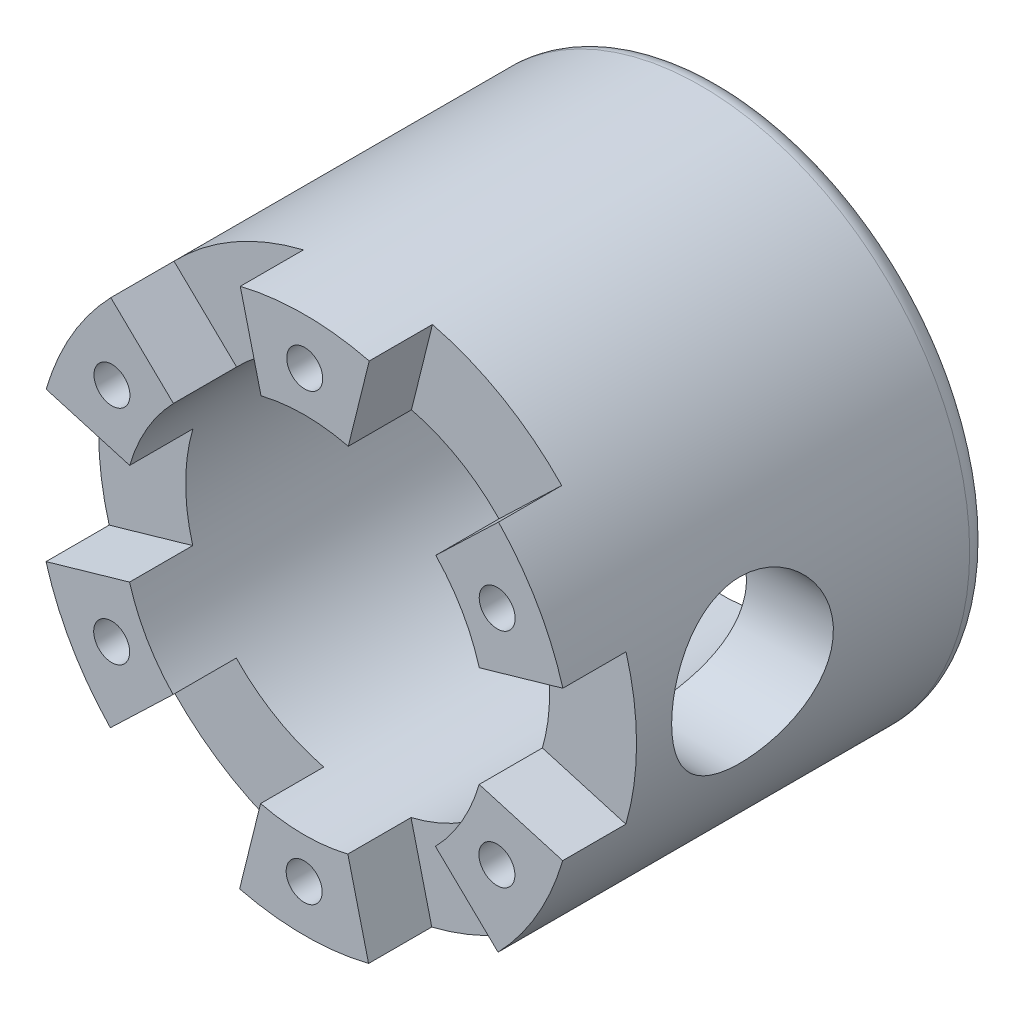
from build123d import *

# Parameters (mm, degrees)
SKETCH1_R                                      = 16.891
BOSS_EXTRUDE1_DEPTH                            = 26.162
SKETCH9_R                                      = 9.525
CUT_EXTRUDE6_DEPTH                             = 36.426854306
SKETCH10_R                                     = 11.43
BOSS_EXTRUDE2_DEPTH                            = 19.05
SKETCH11_R                                     = 9.525
CUT_EXTRUDE7_DEPTH                             = 36.426854306
CUT_EXTRUDE8_DEPTH                             = 3.96875
CSK_FOR_2_FLAT_HEAD_MACHINE_SCREW1_D           = 2.2606
CSK_FOR_2_FLAT_HEAD_MACHINE_SCREW1_CSINK_D     = 4.3688
CSK_FOR_2_FLAT_HEAD_MACHINE_SCREW1_CSINK_ANGLE = 82
CIRPATTERN1_COUNT                              = 6
F_1_2_0_4_DIAMETER_HOLE1_D                     = 10.16
F_1_2_0_4_DIAMETER_HOLE1_DEPTH                 = 12.7
F_1_2_0_4_DIAMETER_HOLE1_TIP                   = 3.052371945
FILLET1_R                                      = 1.27


with BuildPart() as part:
    # Sketch1 → Boss-Extrude1 (new body)
    with BuildSketch(Plane.XY):
        Circle(SKETCH1_R)
    extrude(amount=BOSS_EXTRUDE1_DEPTH)

    # Sketch9 → Cut-Extrude6 (cut, through all)
    with BuildSketch(Plane(origin=(0, 0, 0), x_dir=(-1, 0, 0), z_dir=(0, 0, -1))):
        Circle(SKETCH9_R)
        with BuildLine():
            ThreePointArc((-5.359640753, -7.874), (0, -9.525), (5.359640753, -7.874))
            Line((5.359640753, -7.874), (-5.359640753, -7.874))
        make_face()
        with BuildLine():
            ThreePointArc((-7.874, 5.359640753), (-9.525, 0), (-7.874, -5.359640753))
            Line((-7.874, -5.359640753), (-7.874, 5.359640753))
        make_face()
        with BuildLine():
            Line((-5.359640753, 7.874), (5.359640753, 7.874))
            ThreePointArc((5.359640753, 7.874), (0, 9.525), (-5.359640753, 7.874))
        make_face()
        with BuildLine():
            Line((7.874, 5.359640753), (7.874, -5.359640753))
            ThreePointArc((7.874, -5.359640753), (9.102897204, -2.804084075), (9.525, 0))
            ThreePointArc((9.525, 0), (9.102897204, 2.804084075), (7.874, 5.359640753))
        make_face()
    extrude(amount=-CUT_EXTRUDE6_DEPTH, mode=Mode.SUBTRACT)

    # Sketch10 → Boss-Extrude2 (add)
    # profile 1 of 2: a face of its own
    with BuildSketch(Plane(origin=(0, 0, 0), x_dir=(-1, 0, 0), z_dir=(0, 0, -1))):
        Circle(SKETCH10_R)
        with BuildLine():
            ThreePointArc((-5.359640753, -7.874), (-4.453933477, 8.419507206), (9.525, 0))
            ThreePointArc((9.525, 0), (8.419507206, -4.453933477), (5.359640753, -7.874))
            ThreePointArc((5.359640753, -7.874), (0, -9.525), (-5.359640753, -7.874))
        make_face(mode=Mode.SUBTRACT)
    # profile 2 of 2: a face of its own
    with BuildSketch(Plane(origin=(0, 0, 0), x_dir=(-1, 0, 0), z_dir=(0, 0, -1))):
        Circle(SKETCH10_R)
        with BuildLine():
            ThreePointArc((-5.359640753, -7.874), (-4.453933477, 8.419507206), (9.525, 0))
            ThreePointArc((9.525, 0), (8.419507206, -4.453933477), (5.359640753, -7.874))
            ThreePointArc((5.359640753, -7.874), (0, -9.525), (-5.359640753, -7.874))
        make_face(mode=Mode.SUBTRACT)
    extrude(amount=-BOSS_EXTRUDE2_DEPTH)

    # Sketch11 → Cut-Extrude7 (cut, through all)
    with BuildSketch(Plane.XY.offset(26.162)):
        with BuildLine():
            Line((-9.153468369, -2.634319991), (-10.984162043, -3.161183989))
            ThreePointArc((-10.984162043, -3.161183989), (1.596234295, -11.317991698), (11.43, 0))
            ThreePointArc((11.43, 0), (1.610471515, 11.315974615), (-10.976173491, 3.188810986))
            Line((-10.976173491, 3.188810986), (-9.146811242, 2.657342489))
            ThreePointArc((-9.146811242, 2.657342489), (1.342059596, 9.429978846), (9.525, 0))
            ThreePointArc((9.525, 0), (1.330195246, -9.431659748), (-9.153468369, -2.634319991))
        make_face()
        Circle(SKETCH11_R)
        with BuildLine():
            ThreePointArc((-10.984162043, -3.161183989), (-11.297244321, 0.014212394), (-10.976173491, 3.188810986))
            Line((-10.976173491, 3.188810986), (0, 0))
            Line((0, 0), (-10.984162043, -3.161183989))
        make_face()
        with BuildLine():
            ThreePointArc((-10.976173491, 3.188810986), (-11.429990955, 0.014379395), (-10.984162043, -3.161183989))
            ThreePointArc((-10.984162043, -3.161183989), (-11.297244321, 0.014212394), (-10.976173491, 3.188810986))
        make_face()
    extrude(amount=-CUT_EXTRUDE7_DEPTH, mode=Mode.SUBTRACT)

    # Sketch11<4> → Cut-Extrude8 (cut)
    with BuildSketch(Plane.XY.offset(26.162)):
        with BuildLine():
            ThreePointArc((-10.976173491, 3.188810986), (-11.297244321, 0.014212394), (-10.984162043, -3.161183989))
            Line((-10.984162043, -3.161183989), (0, 0))
            Line((0, 0), (-10.976173491, 3.188810986))
        make_face()
        with BuildLine():
            ThreePointArc((-10.976173491, 3.188810986), (-11.429990955, 0.014379395), (-10.984162043, -3.161183989))
            ThreePointArc((-10.984162043, -3.161183989), (-11.297244321, 0.014212394), (-10.976173491, 3.188810986))
        make_face()
        with BuildLine():
            Line((-16.232150575, -4.67152745), (-10.984162043, -3.161183989))
            ThreePointArc((-10.984162043, -3.161183989), (-11.429990955, 0.014379395), (-10.976173491, 3.188810986))
            Line((-10.976173491, 3.188810986), (-16.220345269, 4.712354013))
            ThreePointArc((-16.220345269, 4.712354013), (-16.925737574, 0.021293268), (-16.232150575, -4.67152745))
        make_face()
        with BuildLine():
            Line((0, 0), (-10.984162043, -3.161183989))
            ThreePointArc((-10.984162043, -3.161183989), (1.596234295, -11.317991698), (11.43, 0))
            ThreePointArc((11.43, 0), (1.610471515, 11.315974615), (-10.976173491, 3.188810986))
            Line((-10.976173491, 3.188810986), (0, 0))
        make_face()
    cut_extrude8 = extrude(amount=-CUT_EXTRUDE8_DEPTH, mode=Mode.SUBTRACT)

    # CSK for #2 Flat Head Machine Screw1 (through all)
    with Locations(Plane(origin=(0, 0, 0), x_dir=(-1, 0, 0), z_dir=(0, 0, -1))):
        with Locations((12.089577909, 7.000214709)):
            csk_for_2_flat_head_machine_screw1 = CounterSinkHole(CSK_FOR_2_FLAT_HEAD_MACHINE_SCREW1_D / 2, CSK_FOR_2_FLAT_HEAD_MACHINE_SCREW1_CSINK_D / 2, counter_sink_angle=CSK_FOR_2_FLAT_HEAD_MACHINE_SCREW1_CSINK_ANGLE)

    # CirPattern1: Cut-Extrude8, CSK for #2 Flat Head Machine Screw1 ×6 about axis
    cirpattern1_axis = Axis((0, 0, 0), (0, 0, 1))
    add([cut_extrude8.rotate(cirpattern1_axis, i * 360 / CIRPATTERN1_COUNT) for i in range(1, CIRPATTERN1_COUNT)], mode=Mode.SUBTRACT)
    add([csk_for_2_flat_head_machine_screw1.rotate(cirpattern1_axis, i * 360 / CIRPATTERN1_COUNT) for i in range(1, CIRPATTERN1_COUNT)], mode=Mode.SUBTRACT)

    # 1/2 (0.4) Diameter Hole1
    with Locations(Plane(origin=(16.890986634, -0.02124955, 14.908061188), x_dir=(0.001258039772, 0.999999208668, 0), z_dir=(0.999999208668, -0.001258039772, 0))):
        with Locations((0, 0)):
            Hole(F_1_2_0_4_DIAMETER_HOLE1_D / 2, depth=F_1_2_0_4_DIAMETER_HOLE1_DEPTH)
            with Locations((0, 0, -(F_1_2_0_4_DIAMETER_HOLE1_DEPTH + F_1_2_0_4_DIAMETER_HOLE1_TIP / 2))):  # 118° drill point
                Cone(0, F_1_2_0_4_DIAMETER_HOLE1_D / 2, F_1_2_0_4_DIAMETER_HOLE1_TIP, mode=Mode.SUBTRACT)

    # Fillet1
    # the kernel refuses this fillet: 1.27 mm, written as the material it takes off along each edge
    with BuildSketch(Plane(origin=(0, 0, 0), x_dir=(1, 0, 0), z_dir=(0, -1, 0))) as fillet1_piece_1:
        with BuildLine():
            CenterArc((16.891 - FILLET1_R, FILLET1_R), FILLET1_R, 270, 90)
            Line((16.891 - FILLET1_R, 0), (16.891, 0))
            Line((16.891, 0), (16.891, FILLET1_R))
        make_face()
    revolve(axis=Axis((0, 0, 0), (0, 0, 1)), mode=Mode.SUBTRACT)


solid = part.part
